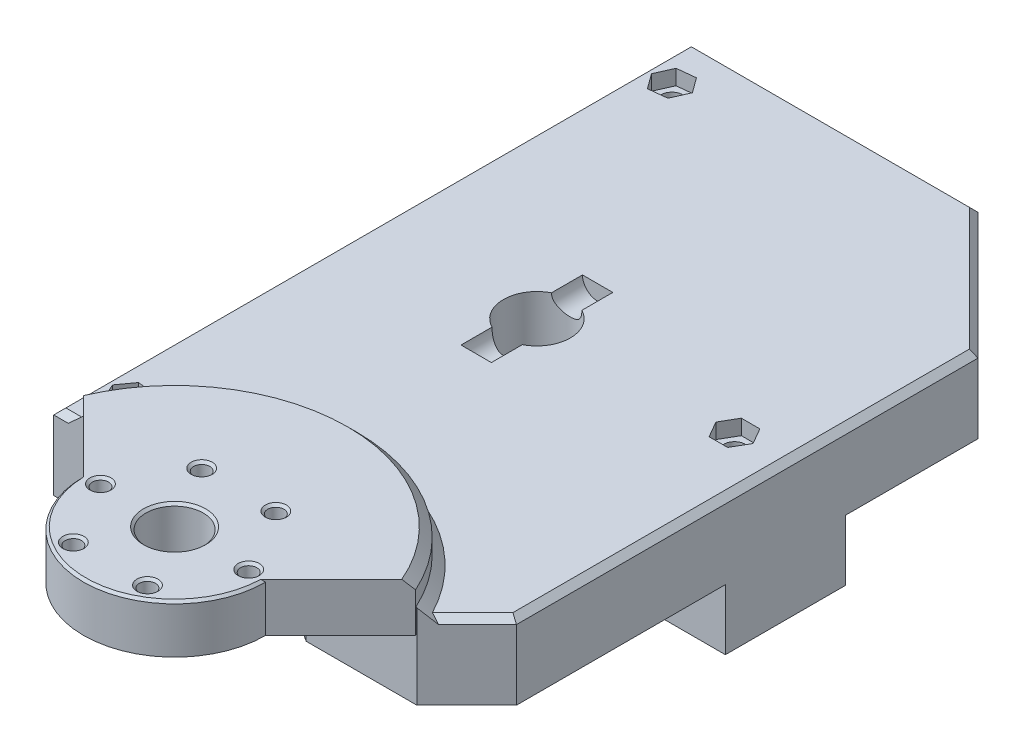
from build123d import *

# Parameters (mm, degrees)
SKETCH1_W               = 86.36
SKETCH1_H               = 133.35
BOSS_EXTRUDE1_DEPTH     = 15.875
SKETCH2_W               = 86.36
SKETCH2_H               = 25.146
BOSS_EXTRUDE2_DEPTH     = 12.7
SKETCH5_R               = 1.7
SKETCH5_R_2             = 6
BOSS_EXTRUDE3_DEPTH     = 3.81
SKETCH6_R               = 19.685
CUT_EXTRUDE1_DEPTH      = 19.05
CHAMFER2_SIZE           = 0.508
SKETCH5_4_R             = 1.7
SKETCH5_4_R_2           = 6
BOSS_EXTRUDE4_DEPTH     = 6.35
CHAMFER1_SIZE           = 1.905
SKETCH7_R               = 5.08
CUT_EXTRUDE2_DEPTH      = 6.35
CUT_EXTRUDE3_DEPTH      = 3.175
CUT_EXTRUDE4_DEPTH      = 115.033341725
CUT_EXTRUDE4_DEPTH_BACK = 115.033341725
SKETCH8_3_R             = 2.2225
CUT_EXTRUDE5_DEPTH      = 115.033341725
CUT_EXTRUDE5_DEPTH_BACK = 115.033341725
SKETCH10_R              = 6.985
CUT_EXTRUDE6_DEPTH      = 12.7
CUT_EXTRUDE6_DEPTH_BACK = 12.7
SKETCH11_R              = 3.175
CHAMFER3_SIZE           = 26.416
CHAMFER4_SIZE           = 10.414
SKETCH13_R              = 19.05
CUT_EXTRUDE7_DEPTH      = 12.7
CHAMFER5_SIZE           = 1.27


with BuildPart() as part:
    # Sketch1 → Boss-Extrude1 (new body)
    with BuildSketch(Plane(origin=(0, 0, 0), x_dir=(1, 0, 0), z_dir=(0, 1, 0))):
        Rectangle(SKETCH1_W, SKETCH1_H)
    extrude(amount=BOSS_EXTRUDE1_DEPTH)

    # Sketch2 → Boss-Extrude2 (add)
    with BuildSketch(Plane.XZ):
        Rectangle(SKETCH2_W, SKETCH2_H)
    extrude(amount=BOSS_EXTRUDE2_DEPTH)

    # Sketch6 → Cut-Extrude1 (cut)
    with BuildSketch(Plane.XZ):
        with Locations((-2.032, 82.55)):
            Circle(SKETCH6_R)
    extrude(amount=-CUT_EXTRUDE1_DEPTH, mode=Mode.SUBTRACT)



with BuildPart() as body_2:
    # Sketch5 → Boss-Extrude3 (new body)
    with BuildSketch(Plane(origin=(0, 19.05, 0), x_dir=(-1, 0, 0), z_dir=(0, -1, 0))):
        with BuildLine():
            Line((-32.693781238, -66.874218762), (-17.018, -82.55))
            ThreePointArc((-17.018, -82.55), (2.032, -101.6), (21.082, -82.55))
            Line((21.082, -82.55), (36.757781238, -66.874218762))
            ThreePointArc((36.757781238, -66.874218762), (2.032, -44.45), (-32.693781238, -66.874218762))
        make_face()
        with Locations(Location((9.782, -69.126606241, 0), (0, 0, 90))):
            Circle(SKETCH5_R, mode=Mode.SUBTRACT)
        with Locations(Location((-5.718, -69.126606241, 0), (0, 0, 90))):
            Circle(SKETCH5_R, mode=Mode.SUBTRACT)
        with Locations(Location((-13.468, -82.55, 0), (0, 0, 90))):
            Circle(SKETCH5_R, mode=Mode.SUBTRACT)
        with Locations(Location((-5.718, -95.973393759, 0), (0, 0, 90))):
            Circle(SKETCH5_R, mode=Mode.SUBTRACT)
        with Locations(Location((9.782, -95.973393759, 0), (0, 0, 90))):
            Circle(SKETCH5_R, mode=Mode.SUBTRACT)
        with Locations(Location((17.532, -82.55, 0), (0, 0, 90))):
            Circle(SKETCH5_R, mode=Mode.SUBTRACT)
        with Locations(Location((2.032, -82.55, 0), (0, 0, 90))):
            Circle(SKETCH5_R_2, mode=Mode.SUBTRACT)
    extrude(amount=-BOSS_EXTRUDE3_DEPTH)

    # Chamfer2
    chamfer2_edges = [body_2.edges().sort_by_distance(p)[0] for p in [
        (-9.782, 22.86, 70.826606241),
        (-17.532, 22.86, 84.25),
        (-9.782, 22.86, 97.673393759),
        (5.718, 22.86, 97.673393759),
        (13.468, 22.86, 84.25),
        (5.718, 22.86, 70.826606241),
        (-2.032, 22.86, 101.6),
        (-2.032, 22.86, 88.55),
    ]]
    chamfer(chamfer2_edges, length=CHAMFER2_SIZE)


with BuildPart() as part_1:
    add(part.part)

    add(body_2.part)  # Boss-Extrude4 merges body 2
    # Sketch5<4> → Boss-Extrude4 (add)
    with BuildSketch(Plane(origin=(0, 19.05, 0), x_dir=(-1, 0, 0), z_dir=(0, -1, 0))):
        with BuildLine():
            Line((-32.693781238, -66.874218762), (-17.018, -82.55))
            ThreePointArc((-17.018, -82.55), (2.032, -101.6), (21.082, -82.55))
            Line((21.082, -82.55), (36.757781238, -66.874218762))
            ThreePointArc((36.757781238, -66.874218762), (2.032, -44.45), (-32.693781238, -66.874218762))
        make_face()
        with Locations(Location((9.782, -69.126606241, 0), (0, 0, 90))):
            Circle(SKETCH5_4_R, mode=Mode.SUBTRACT)
        with Locations(Location((-5.718, -69.126606241, 0), (0, 0, 90))):
            Circle(SKETCH5_4_R, mode=Mode.SUBTRACT)
        with Locations(Location((-13.468, -82.55, 0), (0, 0, 90))):
            Circle(SKETCH5_4_R, mode=Mode.SUBTRACT)
        with Locations(Location((-5.718, -95.973393759, 0), (0, 0, 90))):
            Circle(SKETCH5_4_R, mode=Mode.SUBTRACT)
        with Locations(Location((9.782, -95.973393759, 0), (0, 0, 90))):
            Circle(SKETCH5_4_R, mode=Mode.SUBTRACT)
        with Locations(Location((17.532, -82.55, 0), (0, 0, 90))):
            Circle(SKETCH5_4_R, mode=Mode.SUBTRACT)
        with Locations(Location((2.032, -82.55, 0), (0, 0, 90))):
            Circle(SKETCH5_4_R_2, mode=Mode.SUBTRACT)
    extrude(amount=BOSS_EXTRUDE4_DEPTH)

    # Chamfer1
    chamfer1_edges = [part_1.edges().sort_by_distance(p)[0] for p in [
        (-2.032, 15.875, 44.45),
        (-2.032, 22.86, 44.45),
    ]]
    chamfer(chamfer1_edges, length=CHAMFER1_SIZE)

    # Sketch7 → Cut-Extrude2 (cut)
    with BuildSketch(Plane(origin=(0, 15.875, 0), x_dir=(1, 0, 0), z_dir=(0, 1, 0))):
        with Locations((-37.338, -56.769)):
            Circle(SKETCH7_R)
    extrude(amount=CUT_EXTRUDE2_DEPTH, mode=Mode.SUBTRACT)

    # Sketch8 → Cut-Extrude3 (cut)
    with BuildSketch(Plane(origin=(0, 15.875, 0), x_dir=(1, 0, 0), z_dir=(0, 1, 0))):
        Polygon((-35.046242541, -53.63053412), (-38.910112452, -53.215046881), (-41.201869911, -56.353512761), (-39.629757459, -59.90746588), (-35.765887548, -60.322953119), (-33.474130089, -57.184487239), align=None)
        Polygon((-35.765887548, 60.322953119), (-33.474130089, 57.184487239), (-35.046242541, 53.63053412), (-38.910112452, 53.215046881), (-41.201869911, 56.353512761), (-39.629757459, 59.90746588), align=None)
        Polygon((28.625855338, 0), (30.568927669, -3.3655), (34.455072331, -3.3655), (36.398144662, 0), (34.455072331, 3.3655), (30.568927669, 3.3655), align=None)
    extrude(amount=-CUT_EXTRUDE3_DEPTH, mode=Mode.SUBTRACT)

    # Sketch8<3> → Cut-Extrude4 (cut, two sides: drawn at the far end of the back side and taken through both)
    with BuildSketch(Plane(origin=(0, 15.875, 0), x_dir=(1, 0, 0), z_dir=(0, 1, 0)).offset(-CUT_EXTRUDE4_DEPTH_BACK)):
        with Locations(Location((-37.338, -56.769, 0), (0, 0, 270))):
            Circle(SKETCH8_3_R)
        with Locations(Location((-37.338, 56.769, 0), (0, 0, 270))):
            Circle(SKETCH8_3_R)
        with Locations(Location((32.512, 0, 0), (0, 0, 270))):
            Circle(SKETCH8_3_R)
    extrude(amount=CUT_EXTRUDE4_DEPTH + CUT_EXTRUDE4_DEPTH_BACK, mode=Mode.SUBTRACT)

    # Sketch10 → Cut-Extrude5 (cut, two sides: drawn at the far end of the back side and taken through both)
    with BuildSketch(Plane(origin=(0, 15.875, 0), x_dir=(1, 0, 0), z_dir=(0, 1, 0)).offset(-CUT_EXTRUDE5_DEPTH_BACK)):
        with Locations(Location((-8.807904265, 0, 0), (0, 0, 270))):
            Circle(SKETCH10_R)
    extrude(amount=CUT_EXTRUDE5_DEPTH + CUT_EXTRUDE5_DEPTH_BACK, mode=Mode.SUBTRACT)

    # Sketch11 → Cut-Extrude6 (cut, two sides: drawn at the far end of the back side and taken through both)
    with BuildSketch(Plane.XY.offset(-CUT_EXTRUDE6_DEPTH_BACK)):
        with Locations((-8.807000374, 15.875)):
            Circle(SKETCH11_R)
    extrude(amount=CUT_EXTRUDE6_DEPTH + CUT_EXTRUDE6_DEPTH_BACK, mode=Mode.SUBTRACT)

    # Chamfer3
    chamfer3_edges = [part_1.edges().sort_by_distance(p)[0] for p in [
        (43.18, 7.9375, -66.675),
    ]]
    chamfer(chamfer3_edges, length=CHAMFER3_SIZE)

    # Chamfer4
    # the kernel refuses this chamfer: 10.414 mm, written as the material it takes off along each edge
    with BuildSketch(Plane(origin=(43.18, -26.781506637, 66.675), x_dir=(0.02749587661058629, 0, -0.9996219169112966), z_dir=(0, 1, 0))) as chamfer4_piece_1:
        Polygon((CHAMFER4_SIZE * 0.999621916911, CHAMFER4_SIZE * 0.0274958766106), (-CHAMFER4_SIZE * 0.0274958766106, CHAMFER4_SIZE * 0.999621916911), (0, 0), align=None)
    extrude(amount=69.438013273, mode=Mode.SUBTRACT)

    # Sketch13 → Cut-Extrude7 (cut)
    with BuildSketch(Plane.XZ.offset(12.7)):
        with Locations((-8.807904265, 0)):
            Circle(SKETCH13_R)
    extrude(amount=-CUT_EXTRUDE7_DEPTH, mode=Mode.SUBTRACT)

    # Chamfer5
    chamfer5_edges = [part_1.edges().sort_by_distance(p)[0] for p in [
        (-40.966177014, 15.875, 66.675),
        (-43.18, 15.875, 0),
        (-13.208, 15.875, -66.675),
        (29.972, 15.875, -53.467),
        (43.18, 15.875, 8.001),
        (38.634041338, 15.875, 60.806958662),
    ]]
    chamfer(chamfer5_edges, length=CHAMFER5_SIZE)


solid = part_1.part
